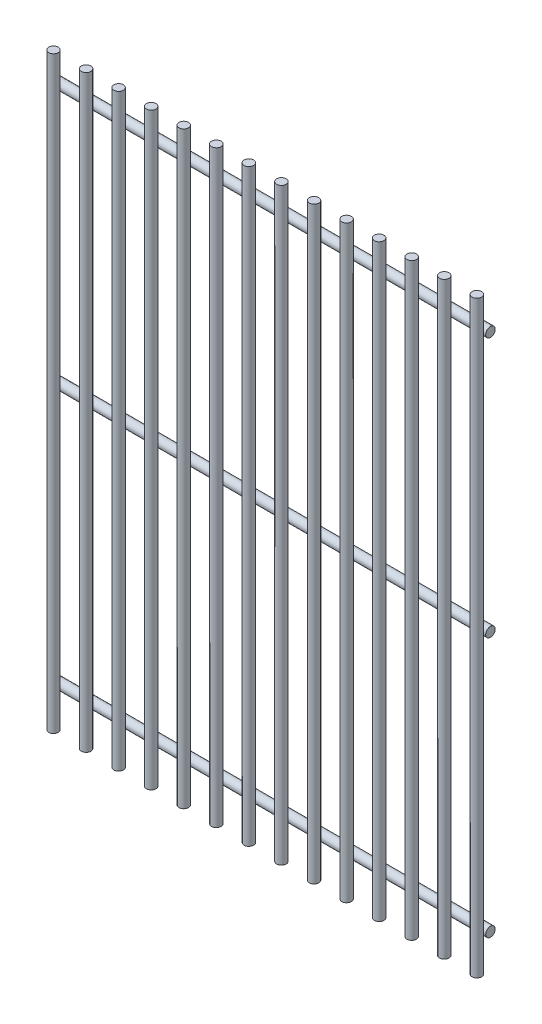
from build123d import *

# Parameters (mm, degrees)
SKETCH1_R           = 3.5
BOSS_EXTRUDE1_DEPTH = 215.9
LPATTERN1_COUNT     = 14
LPATTERN1_PITCH     = 23.884615387
SKETCH2_R           = 3.5
BOSS_EXTRUDE2_DEPTH = 158.75


with BuildPart() as part:
    # Sketch1 → Boss-Extrude1 (new, symmetric)
    with BuildSketch(Plane(origin=(0, 0, 0), x_dir=(1, 0, 0), z_dir=(0, 1, 0))):
        with Locations((-155.25, -3.5)):
            Circle(SKETCH1_R)
    extrude(amount=BOSS_EXTRUDE1_DEPTH, both=True)


with BuildPart() as lpattern1_1:
    # LPattern1: pattern copy
    add(part.part.moved(Location(Vector(1, 0, 0) * (1 * LPATTERN1_PITCH))))


with BuildPart() as lpattern1_2:
    # LPattern1: pattern copy
    add(part.part.moved(Location(Vector(1, 0, 0) * (2 * LPATTERN1_PITCH))))


with BuildPart() as lpattern1_3:
    # LPattern1: pattern copy
    add(part.part.moved(Location(Vector(1, 0, 0) * (3 * LPATTERN1_PITCH))))


with BuildPart() as lpattern1_4:
    # LPattern1: pattern copy
    add(part.part.moved(Location(Vector(1, 0, 0) * (4 * LPATTERN1_PITCH))))


with BuildPart() as lpattern1_5:
    # LPattern1: pattern copy
    add(part.part.moved(Location(Vector(1, 0, 0) * (5 * LPATTERN1_PITCH))))


with BuildPart() as lpattern1_6:
    # LPattern1: pattern copy
    add(part.part.moved(Location(Vector(1, 0, 0) * (6 * LPATTERN1_PITCH))))


with BuildPart() as lpattern1_7:
    # LPattern1: pattern copy
    add(part.part.moved(Location(Vector(1, 0, 0) * (7 * LPATTERN1_PITCH))))


with BuildPart() as lpattern1_8:
    # LPattern1: pattern copy
    add(part.part.moved(Location(Vector(1, 0, 0) * (8 * LPATTERN1_PITCH))))


with BuildPart() as lpattern1_9:
    # LPattern1: pattern copy
    add(part.part.moved(Location(Vector(1, 0, 0) * (9 * LPATTERN1_PITCH))))


with BuildPart() as lpattern1_10:
    # LPattern1: pattern copy
    add(part.part.moved(Location(Vector(1, 0, 0) * (10 * LPATTERN1_PITCH))))


with BuildPart() as lpattern1_11:
    # LPattern1: pattern copy
    add(part.part.moved(Location(Vector(1, 0, 0) * (11 * LPATTERN1_PITCH))))


with BuildPart() as lpattern1_12:
    # LPattern1: pattern copy
    add(part.part.moved(Location(Vector(1, 0, 0) * (12 * LPATTERN1_PITCH))))


with BuildPart() as lpattern1_13:
    # LPattern1: pattern copy
    add(part.part.moved(Location(Vector(1, 0, 0) * (13 * LPATTERN1_PITCH))))


with BuildPart() as part_1:
    add(part.part)

    add(lpattern1_1.part)  # Boss-Extrude2 merges LPattern1_1

    add(lpattern1_2.part)  # Boss-Extrude2 merges LPattern1_2

    add(lpattern1_3.part)  # Boss-Extrude2 merges LPattern1_3

    add(lpattern1_4.part)  # Boss-Extrude2 merges LPattern1_4

    add(lpattern1_5.part)  # Boss-Extrude2 merges LPattern1_5

    add(lpattern1_6.part)  # Boss-Extrude2 merges LPattern1_6

    add(lpattern1_7.part)  # Boss-Extrude2 merges LPattern1_7

    add(lpattern1_8.part)  # Boss-Extrude2 merges LPattern1_8

    add(lpattern1_9.part)  # Boss-Extrude2 merges LPattern1_9

    add(lpattern1_10.part)  # Boss-Extrude2 merges LPattern1_10

    add(lpattern1_11.part)  # Boss-Extrude2 merges LPattern1_11

    add(lpattern1_12.part)  # Boss-Extrude2 merges LPattern1_12

    add(lpattern1_13.part)  # Boss-Extrude2 merges LPattern1_13
    # Sketch2 → Boss-Extrude2 (add, symmetric)
    with BuildSketch(Plane(origin=(0, 0, 0), x_dir=(0, 0, -1), z_dir=(1, 0, 0))):
        with Locations((3, -190.5)):
            Circle(SKETCH2_R)
        with Locations((3, 190.5)):
            Circle(SKETCH2_R)
        with Locations((3, 0)):
            Circle(SKETCH2_R)
    extrude(amount=BOSS_EXTRUDE2_DEPTH, both=True)


solid = part_1.part
